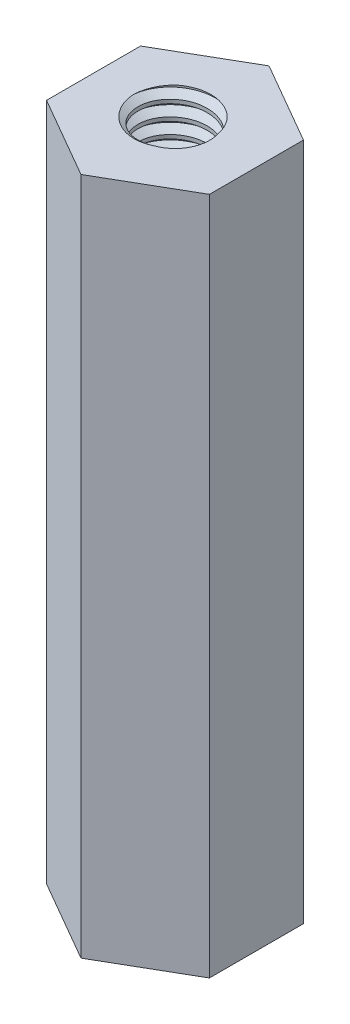
from build123d import *

# Parameters (mm, degrees)
SKETCH1_R           = 1.025
BOSS_EXTRUDE1_DEPTH = 10
THREAD1_PITCH       = 0.45
BOSS_EXTRUDE2_DEPTH = 5


with BuildPart() as part:
    # Sketch1 → Boss-Extrude1 (new, symmetric)
    with BuildSketch(Plane(origin=(0, 0, 0), x_dir=(1, 0, 0), z_dir=(0, 1, 0))):
        Polygon((2.4, 1.385640646), (0, 2.771281292), (-2.4, 1.385640646), (-2.4, -1.385640646), (0, -2.771281292), (2.4, -1.385640646), align=None)
        with Locations(Location((0, 0, 0), (0, 0, 270))):
            Circle(SKETCH1_R, mode=Mode.SUBTRACT)
    extrude(amount=BOSS_EXTRUDE1_DEPTH, both=True)

    # Thread1: the profile of Thread Profile1 profile screwed along a right-hand helix of 53.333333 turns, 6 arcs to a turn; built about Z, then put on its axis
    thread1_z = Axis((0, 0, 0), (0, 0, 1))
    thread1_corners = [(1.0247, 0, -0.000173205), (1.268569644, 0, 0.140624999), (1.268569644, 0, 0.196874999), (1.0247, 0, 0.337673204)]
    with BuildLine(mode=Mode.PRIVATE) as thread1_profile:
        Line(thread1_corners[0], thread1_corners[1])
        Line(thread1_corners[1], thread1_corners[2])
        Line(thread1_corners[2], thread1_corners[3])
        Line(thread1_corners[3], thread1_corners[0])
    thread1_cap = Face(thread1_profile.wire())
    thread1_turn_angles = [0, 30, 60, 90, 120, 150, 180, 210, 240, 270, 300, 330, 360]
    thread1_turn_weights = [1, 0.8660254037844387, 1, 0.8660254037844387, 1, 0.8660254037844387, 1, 0.8660254037844387, 1, 0.8660254037844387, 1, 0.8660254037844387, 1]
    thread1_turn_rails = [Edge.make_bspline([Vector(p[0], p[1], 0).rotate(thread1_z, thread1_turn_angles[k]) / thread1_turn_weights[k] + Vector(0, 0, p[2] + THREAD1_PITCH * thread1_turn_angles[k] / 360) for k in range(13)], [0, 0, 0, 1, 1, 2, 2, 3, 3, 4, 4, 5, 5, 6, 6, 6], 2, thread1_turn_weights) for p in thread1_corners]
    thread1_turn_sides = [Face.make_surface_from_curves(thread1_turn_rails[p[0]], thread1_turn_rails[p[1]]) for p in [(0, 1), (1, 2), (2, 3), (3, 0)]]
    thread1_turn = Solid(Shell([*thread1_turn_sides, thread1_cap, thread1_cap.rotate(thread1_z, 360).moved(Location((0, 0, THREAD1_PITCH * 360 / 360)))]))
    thread1_last_angles = [19080, 19110, 19140, 19170, 19200]
    thread1_last_weights = [1, 0.8660254037844387, 1, 0.8660254037844228, 1]
    thread1_last_rails = [Edge.make_bspline([Vector(p[0], p[1], 0).rotate(thread1_z, thread1_last_angles[k]) / thread1_last_weights[k] + Vector(0, 0, p[2] + THREAD1_PITCH * thread1_last_angles[k] / 360) for k in range(5)], [0, 0, 0, 1, 1, 2, 2, 2], 2, thread1_last_weights) for p in thread1_corners]
    thread1_last_sides = [Face.make_surface_from_curves(thread1_last_rails[p[0]], thread1_last_rails[p[1]]) for p in [(0, 1), (1, 2), (2, 3), (3, 0)]]
    thread1_last = Solid(Shell([*thread1_last_sides, thread1_cap.rotate(thread1_z, 19080).moved(Location((0, 0, THREAD1_PITCH * 19080 / 360))), thread1_cap.rotate(thread1_z, 19200).moved(Location((0, 0, THREAD1_PITCH * 19200 / 360)))]))
    thread1_each = [*[thread1_turn.moved(Location((0, 0, THREAD1_PITCH * i))) for i in range(53)], thread1_last]
    add(Plane(origin=(0, 12, 0), x_dir=(-1, 0, 0), z_dir=(0, -1, 0)) * Compound([thread1_each[i] for i in range(0, 54, 2)]), mode=Mode.SUBTRACT)
    add(Plane(origin=(0, 12, 0), x_dir=(-1, 0, 0), z_dir=(0, -1, 0)) * Compound([thread1_each[i] for i in range(1, 54, 2)]), mode=Mode.SUBTRACT)

    # Sketch2 → Boss-Extrude2 (add, symmetric)
    with BuildSketch(Plane(origin=(0, 0, 0), x_dir=(1, 0, 0), z_dir=(0, 1, 0))):
        Polygon((2.4, -1.385640646), (2.4, 1.385640646), (0, 2.771281292), (-2.4, 1.385640646), (-2.4, -1.385640646), (0, -2.771281292), align=None)
    extrude(amount=BOSS_EXTRUDE2_DEPTH, both=True)


solid = part.part
